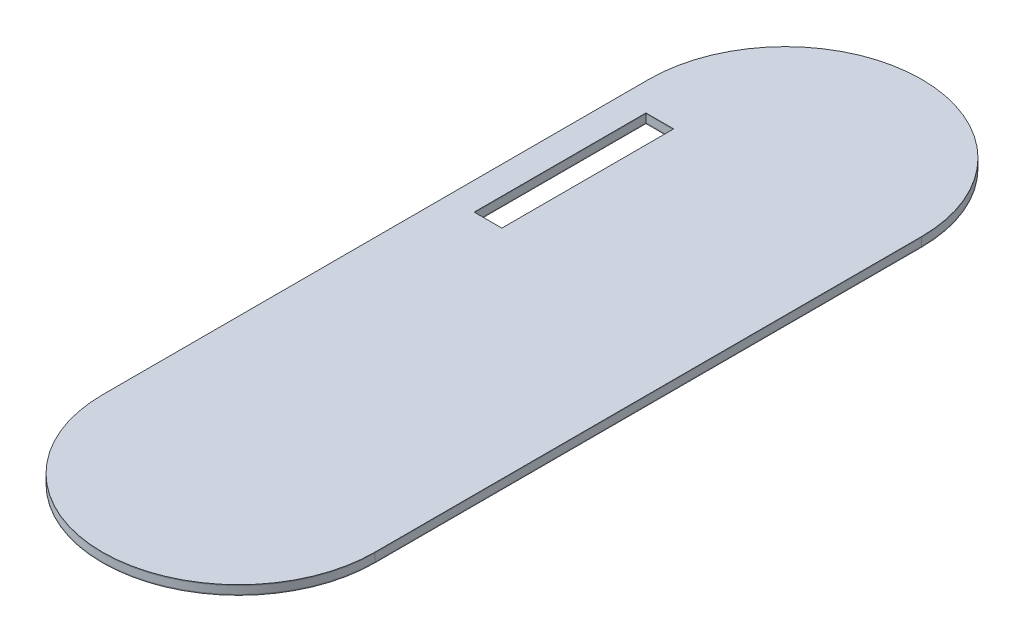
from build123d import *

# Parameters (mm, degrees)
SKETCH1_W           = 9
SKETCH1_H           = 55.88
BOSS_EXTRUDE1_DEPTH = 0.25
SKETCH2_W           = 9
SKETCH2_H           = 55.88
BOSS_EXTRUDE3_DEPTH = 2.5
SKETCH3_W           = 9
SKETCH3_H           = 55.88
BOSS_EXTRUDE4_DEPTH = 0.25


with BuildPart() as part:
    # Sketch1 → Boss-Extrude1 (new body)
    with BuildSketch(Plane(origin=(0, 0, 0), x_dir=(1, 0, 0), z_dir=(0, 1, 0))):
        with BuildLine():
            Line((44.323, 88.9), (44.323, -88.9))
            ThreePointArc((44.323, -88.9), (0, -133.223), (-44.323, -88.9))
            Line((-44.323, -88.9), (-44.323, 88.9))
            ThreePointArc((-44.323, 88.9), (0, 133.223), (44.323, 88.9))
        make_face()
        with Locations((-30.823, 50.96)):
            Rectangle(SKETCH1_W, SKETCH1_H, mode=Mode.SUBTRACT)
    extrude(amount=BOSS_EXTRUDE1_DEPTH)


with BuildPart() as body_2:
    # Sketch2 → Boss-Extrude3 (new body)
    with BuildSketch(Plane(origin=(0, 0.25, 0), x_dir=(1, 0, 0), z_dir=(0, 1, 0))):
        with BuildLine():
            ThreePointArc((44.323, 88.9), (0, 133.223), (-44.323, 88.9))
            Line((-44.323, 88.9), (-44.323, -88.9))
            ThreePointArc((-44.323, -88.9), (0, -133.223), (44.323, -88.9))
            Line((44.323, -88.9), (44.323, 88.9))
        make_face()
        with Locations((-30.823, 50.96)):
            Rectangle(SKETCH2_W, SKETCH2_H, mode=Mode.SUBTRACT)
    extrude(amount=BOSS_EXTRUDE3_DEPTH)


with BuildPart() as body_3:
    # Sketch3 → Boss-Extrude4 (new body)
    with BuildSketch(Plane(origin=(0, 2.75, 0), x_dir=(1, 0, 0), z_dir=(0, 1, 0))):
        with BuildLine():
            ThreePointArc((-44.323, -88.9), (0, -133.223), (44.323, -88.9))
            Line((44.323, -88.9), (44.323, 88.9))
            ThreePointArc((44.323, 88.9), (0, 133.223), (-44.323, 88.9))
            Line((-44.323, 88.9), (-44.323, -88.9))
        make_face()
        with Locations((-30.823, 50.96)):
            Rectangle(SKETCH3_W, SKETCH3_H, mode=Mode.SUBTRACT)
    extrude(amount=BOSS_EXTRUDE4_DEPTH)


solid = Compound([part.part, body_2.part, body_3.part])
